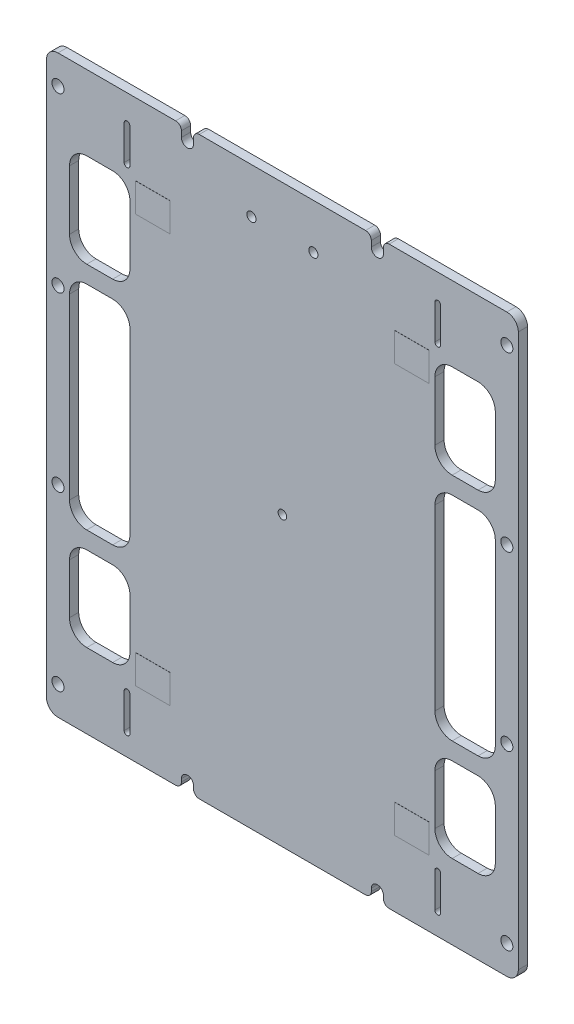
from build123d import *

# Parameters (mm, degrees)
BOARDOUTLINE_DEPTH          = 1.6
SKETCH2_R                   = 0.75
SKETCH2_R_2                 = 0.8
COMPONENTHOLES_DEPTH        = 65.680445267
SOLARCELLCONTACTHOLES_DEPTH = 1.6
WINDOWS_1SIDE_DEPTH         = 65.680445267
SKETCH5_W                   = 6
SKETCH5_H                   = 5
CONTACTPADS_DEPTH           = 0.02
M2_CLEARANCE_HOLE1_D        = 2.1
CUT_EXTRUDE1_DEPTH          = 65.680943098
FILLET3_R                   = 1
FILLET3_OF_MIRROR1_R        = 1


with BuildPart() as part:
    # Sketch1 → boardOutline (new body)
    with BuildSketch(Plane.XY):
        with BuildLine():
            Line((-39, -50), (39, -50))
            ThreePointArc((39, -50), (40.414213562, -49.414213562), (41, -48))
            Line((41, -48), (41, 48))
            ThreePointArc((41, 48), (40.414213562, 49.414213562), (39, 50))
            Line((39, 50), (-39, 50))
            ThreePointArc((-39, 50), (-40.414213562, 49.414213562), (-41, 48))
            Line((-41, 48), (-41, -48))
            ThreePointArc((-41, -48), (-40.414213562, -49.414213562), (-39, -50))
        make_face()
    extrude(amount=BOARDOUTLINE_DEPTH)

    # Sketch2 → componentHoles (cut, through all)
    with BuildSketch(Plane.XY.offset(1.6)):
        Circle(SKETCH2_R)
        with Locations((-5.385, 42.15)):
            Circle(SKETCH2_R_2)
        with Locations((5.385, 42.15)):
            Circle(SKETCH2_R_2)
    extrude(amount=-COMPONENTHOLES_DEPTH, mode=Mode.SUBTRACT)

    # Sketch4 → solarCellContactHoles (cut)
    with BuildSketch(Plane.XY.offset(1.6)):
        with BuildLine():
            Line((-27.5, 39.25), (-27.5, 45.25))
            ThreePointArc((-27.5, 45.25), (-27, 45.75), (-26.5, 45.25))
            Line((-26.5, 45.25), (-26.5, 39.25))
            ThreePointArc((-26.5, 39.25), (-27, 38.75), (-27.5, 39.25))
        make_face()
        with BuildLine():
            Line((26.5, 39.25), (26.5, 45.25))
            ThreePointArc((26.5, 45.25), (27, 45.75), (27.5, 45.25))
            Line((27.5, 45.25), (27.5, 39.25))
            ThreePointArc((27.5, 39.25), (27, 38.75), (26.5, 39.25))
        make_face()
        with BuildLine():
            Line((26.5, -46.25), (26.5, -40.25))
            ThreePointArc((26.5, -40.25), (27, -39.75), (27.5, -40.25))
            Line((27.5, -40.25), (27.5, -46.25))
            ThreePointArc((27.5, -46.25), (27, -46.75), (26.5, -46.25))
        make_face()
        with BuildLine():
            Line((-27.5, -46.25), (-27.5, -40.25))
            ThreePointArc((-27.5, -40.25), (-27, -39.75), (-26.5, -40.25))
            Line((-26.5, -40.25), (-26.5, -46.25))
            ThreePointArc((-26.5, -46.25), (-27, -46.75), (-27.5, -46.25))
        make_face()
    extrude(amount=-SOLARCELLCONTACTHOLES_DEPTH, mode=Mode.SUBTRACT)

    # Sketch3 → windows_1side (cut, through all)
    with BuildSketch(Plane.XY.offset(1.6)):
        with BuildLine():
            Line((-34, 37), (-29.5, 37))
            ThreePointArc((-29.5, 37), (-27.378679656, 36.121320344), (-26.5, 34))
            Line((-26.5, 34), (-26.5, 23.7))
            ThreePointArc((-26.5, 23.7), (-27.378679656, 21.578679656), (-29.5, 20.7))
            Line((-29.5, 20.7), (-34, 20.7))
            ThreePointArc((-34, 20.7), (-36.121320344, 21.578679656), (-37, 23.7))
            Line((-37, 23.7), (-37, 34))
            ThreePointArc((-37, 34), (-36.121320344, 36.121320344), (-34, 37))
        make_face()
        with BuildLine():
            Line((-29.5, -22.3), (-34, -22.3))
            ThreePointArc((-34, -22.3), (-36.121320344, -23.178679656), (-37, -25.3))
            Line((-37, -25.3), (-37, -34))
            ThreePointArc((-37, -34), (-36.121320344, -36.121320344), (-34, -37))
            Line((-34, -37), (-29.5, -37))
            ThreePointArc((-29.5, -37), (-27.378679656, -36.121320344), (-26.5, -34))
            Line((-26.5, -34), (-26.5, -25.3))
            ThreePointArc((-26.5, -25.3), (-27.378679656, -23.178679656), (-29.5, -22.3))
        make_face()
        with BuildLine():
            Line((-29.5, -19.3), (-34, -19.3))
            ThreePointArc((-34, -19.3), (-36.121320344, -18.421320344), (-37, -16.3))
            Line((-37, -16.3), (-37, 14.7))
            ThreePointArc((-37, 14.7), (-36.121320344, 16.821320344), (-34, 17.7))
            Line((-34, 17.7), (-29.5, 17.7))
            ThreePointArc((-29.5, 17.7), (-27.378679656, 16.821320344), (-26.5, 14.7))
            Line((-26.5, 14.7), (-26.5, -16.3))
            ThreePointArc((-26.5, -16.3), (-27.378679656, -18.421320344), (-29.5, -19.3))
        make_face()
    windows_1side = extrude(amount=-WINDOWS_1SIDE_DEPTH, mode=Mode.SUBTRACT)

    # Sketch5 → contactPads (add)
    with BuildSketch(Plane.XY.offset(1.6)):
        with Locations((-22.5, 35)):
            Rectangle(SKETCH5_W, SKETCH5_H)
        with Locations((22.5, 35)):
            Rectangle(SKETCH5_W, SKETCH5_H)
        with Locations((22.5, -36)):
            Rectangle(SKETCH5_W, SKETCH5_H)
        with Locations((-22.5, -36)):
            Rectangle(SKETCH5_W, SKETCH5_H)
    extrude(amount=CONTACTPADS_DEPTH)

    # M2 Clearance Hole1 (through all)
    with Locations(Plane(origin=(0, 0, 0), x_dir=(-1, 0, 0), z_dir=(0, 0, -1))):
        with Locations((39, 45), (39, -15), (39, -45), (39, 15)):
            m2_clearance_hole1 = Hole(M2_CLEARANCE_HOLE1_D / 2)

    # Sketch10 → Cut-Extrude1 (cut, symmetric)
    with BuildSketch(Plane(origin=(0, 0, 0), x_dir=(-1, 0, 0), z_dir=(0, 0, -1))):
        with BuildLine():
            Line((15.45, 48), (15.45, 55.073166109))
            ThreePointArc((15.45, 55.073166109), (16.5, 56.123166109), (17.55, 55.073166109))
            Line((17.55, 55.073166109), (17.55, 48))
            ThreePointArc((17.55, 48), (16.5, 46.95), (15.45, 48))
        make_face()
        with BuildLine():
            Line((17.55, -48.5), (17.55, -55.573166109))
            ThreePointArc((17.55, -55.573166109), (16.5, -56.623166109), (15.45, -55.573166109))
            Line((15.45, -55.573166109), (15.45, -48.5))
            ThreePointArc((15.45, -48.5), (16.5, -47.45), (17.55, -48.5))
        make_face()
    cut_extrude1 = extrude(amount=CUT_EXTRUDE1_DEPTH, both=True, mode=Mode.SUBTRACT)

    # Fillet3
    fillet3_edges = [part.edges().sort_by_distance(p)[0] for p in [
        (-17.55, 50, 0.8),
        (-15.45, 50, 0.8),
        (-15.45, -50, 0.8),
        (-17.55, -50, 0.8),
    ]]
    fillet(fillet3_edges, radius=FILLET3_R)

    # Mirror1: windows_1side, M2 Clearance Hole1, Cut-Extrude1 across plane
    add(windows_1side.mirror(Plane(origin=(0, 0, 0), x_dir=(0, 0, 1), z_dir=(1, 0, 0))), mode=Mode.SUBTRACT)
    add(m2_clearance_hole1.mirror(Plane(origin=(0, 0, 0), x_dir=(0, 0, 1), z_dir=(1, 0, 0))), mode=Mode.SUBTRACT)
    add(cut_extrude1.mirror(Plane(origin=(0, 0, 0), x_dir=(0, 0, 1), z_dir=(1, 0, 0))), mode=Mode.SUBTRACT)

    # Fillet3 of Mirror1
    fillet3_of_mirror1_edges = [part.edges().sort_by_distance(p)[0] for p in [
        (17.55, 50, 0.8),
        (15.45, 50, 0.8),
        (15.45, -50, 0.8),
        (17.55, -50, 0.8),
    ]]
    fillet(fillet3_of_mirror1_edges, radius=FILLET3_OF_MIRROR1_R)


solid = part.part
